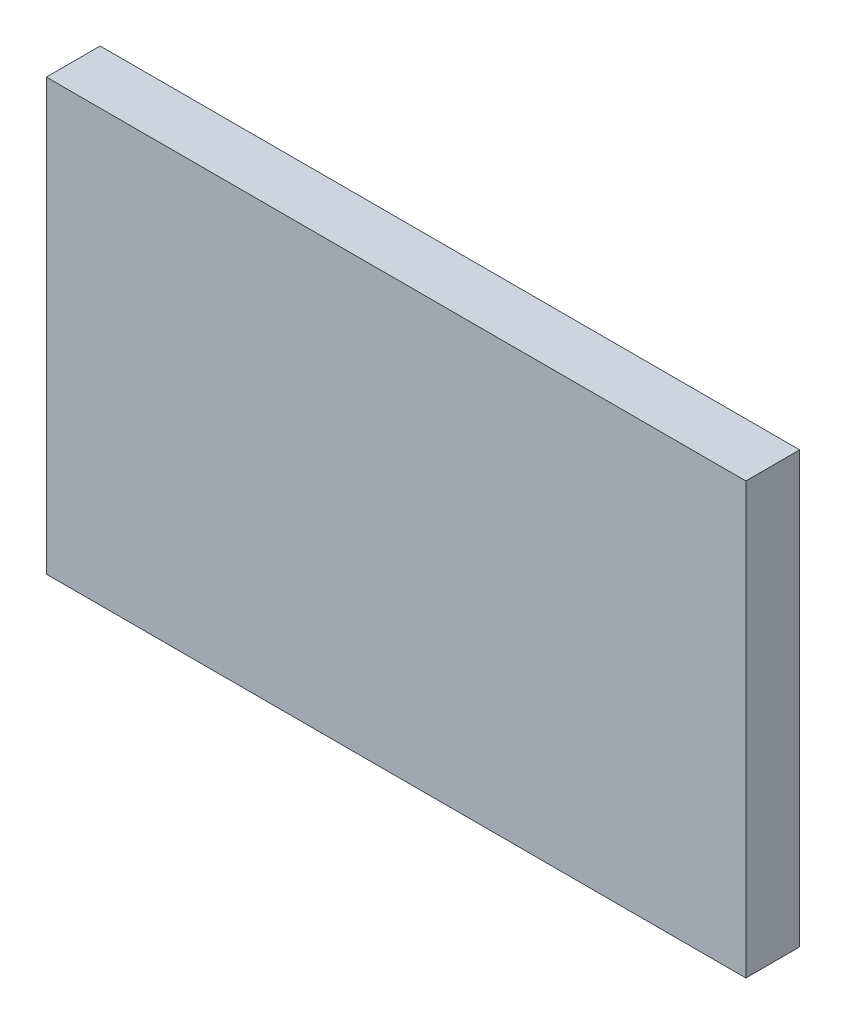
from build123d import *

# Parameters (mm, degrees)
SKETCH1_W            = 15
SKETCH1_H            = 20
BOSS_EXTRUDE1_DEPTH  = 230
SKETCH2_W            = 65
SKETCH2_H            = 40
BOSS_EXTRUDE6_DEPTH  = 5
SKETCH7_W            = 75
SKETCH7_H            = 15
BOSS_EXTRUDE7_DEPTH  = 5
SKETCH8_W            = 75
SKETCH8_H            = 15
BOSS_EXTRUDE8_DEPTH  = 5
SKETCH9_W            = 65
SKETCH9_H            = 40
BOSS_EXTRUDE11_DEPTH = 5
CUT_EXTRUDE1_DEPTH   = 240.635139326


with BuildPart() as part:
    # Sketch1 → Boss-Extrude1 (new body)
    with BuildSketch(Plane.XY):
        Rectangle(SKETCH1_W, SKETCH1_H)
    extrude(amount=BOSS_EXTRUDE1_DEPTH)

    # Sketch10 → Cut-Extrude1 (cut, through all)
    with BuildSketch(Plane.ZY.offset(7.5)):
        with BuildLine():
            Line((209.843145751, 2), (211.343145751, 2))
            ThreePointArc((211.343145751, 2), (223, 0), (211.343145751, -2))
            Line((211.343145751, -2), (209.843145751, -2))
            Line((209.843145751, -2), (209.843145751, 2))
        make_face()
    extrude(amount=-CUT_EXTRUDE1_DEPTH, mode=Mode.SUBTRACT)


with BuildPart() as body_2:
    # Sketch2 → Boss-Extrude6 (new body)
    with BuildSketch(Plane(origin=(0, 0, 0), x_dir=(-1, 0, 0), z_dir=(0, 0, -1))):
        with Locations((0, 30)):
            Rectangle(SKETCH2_W, SKETCH2_H)
    extrude(amount=-BOSS_EXTRUDE6_DEPTH)


with BuildPart() as body_3:
    # Sketch7 → Boss-Extrude7 (new body)
    with BuildSketch(Plane(origin=(32.5, 0, 0), x_dir=(0, 0, -1), z_dir=(1, 0, 0))):
        with Locations((-37.5, 30)):
            Rectangle(SKETCH7_W, SKETCH7_H)
    extrude(amount=BOSS_EXTRUDE7_DEPTH)


with BuildPart() as body_4:
    # Sketch8 → Boss-Extrude8 (new body)
    with BuildSketch(Plane.ZY.offset(32.5)):
        with Locations((37.5, 30)):
            Rectangle(SKETCH8_W, SKETCH8_H)
    extrude(amount=BOSS_EXTRUDE8_DEPTH)


with BuildPart() as body_5:
    # Sketch9 → Boss-Extrude11 (new body)
    with BuildSketch(Plane.XY.offset(75)):
        with Locations((0, 30)):
            Rectangle(SKETCH9_W, SKETCH9_H)
    extrude(amount=-BOSS_EXTRUDE11_DEPTH)


solid = body_2.part
